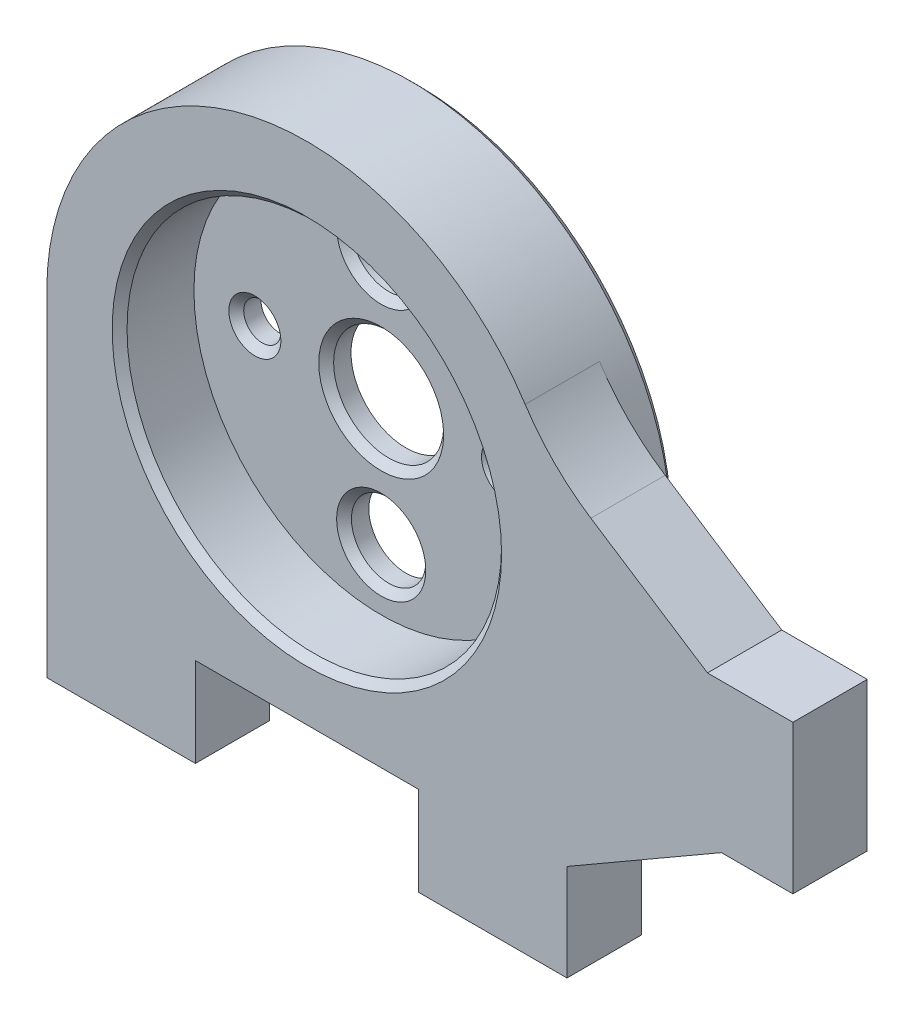
from build123d import *

# Parameters (mm, degrees)
SKETCH1_R           = 12.600000000000001
BOSS_EXTRUDE1_DEPTH = 2.5
BOSS_EXTRUDE3_DEPTH = 2.5
SKETCH4_R           = 1.2499999999999973
SKETCH4_R_2         = 2.5000000000000018
SKETCH4_R_3         = 3.7
BOSS_EXTRUDE4_DEPTH = 2.5
CUT_EXTRUDE1_START  = -0.8333333333333334
SKETCH5_R           = 2.249999999999998
SKETCH5_R_2         = 1.2499999999999973
SKETCH5_R_3         = 2.500000000000002
SKETCH5_R_4         = 3.7
SKETCH5_R_5         = 2.2499999999999987
CUT_EXTRUDE1_DEPTH  = 0.8333333333333334
CHAMFER1_SIZE       = 0.5
CHAMFER2_SIZE       = 0.5
FILLET2_R           = 15
CHAMFER6_SIZE       = 6
CHAMFER6_SIZE2      = 10.392304845413321


with BuildPart() as part:
    # Sketch1 → Boss-Extrude1 (new, symmetric)
    with BuildSketch(Plane.XY):
        with BuildLine():
            Line((-17.5, -22.500000000000004), (-7.500000000000002, -22.500000000000004))
            Line((-7.500000000000002, -22.500000000000004), (-7.500000000000002, -16.5))
            Line((-7.500000000000002, -16.5), (7.500000000000005, -16.5))
            Line((7.500000000000005, -16.5), (7.500000000000007, -22.500000000000004))
            Line((7.500000000000007, -22.500000000000004), (17.500000000000007, -22.5))
            Line((17.500000000000007, -22.5), (17.500000000000004, 0))
            ThreePointArc((17.500000000000004, 0), (-2.81e-15, 17.500000000000004), (-17.500000000000004, -6.94e-15))
            Line((-17.500000000000004, -6.94e-15), (-17.5, -22.500000000000004))
        make_face()
        Circle(SKETCH1_R, mode=Mode.SUBTRACT)
    extrude(amount=BOSS_EXTRUDE1_DEPTH, both=True)

    # Sketch3 → Boss-Extrude3 (add, symmetric)
    with BuildSketch(Plane.XY):
        Polygon((17.500000000000007, -10.000000000000002), (17.500000000000004, 0), (32.70000000000001, 0), (32.70000000000001, -10), align=None)
    extrude(amount=BOSS_EXTRUDE3_DEPTH, both=True)

    # Sketch4 → Boss-Extrude4 (add)
    with BuildSketch(Plane(origin=(0, 0, -2.5), x_dir=(-1, 0, 0), z_dir=(0, 0, -1))):
        with BuildLine():
            Line((5.8309518948453105, -16.5), (-5.8309518948453105, -16.5))
            ThreePointArc((-5.8309518948453105, -16.5), (4.96e-15, 17.500000000000004), (5.8309518948453105, -16.5))
        make_face()
        with Locations((-8.5, 0)):
            Circle(SKETCH4_R, mode=Mode.SUBTRACT)
        with Locations((8.5, 0)):
            Circle(SKETCH4_R, mode=Mode.SUBTRACT)
        with Locations((0, -8.5)):
            Circle(SKETCH4_R_2, mode=Mode.SUBTRACT)
        with Locations((0, 8.5)):
            Circle(SKETCH4_R_2, mode=Mode.SUBTRACT)
        Circle(SKETCH4_R_3, mode=Mode.SUBTRACT)
    extrude(amount=BOSS_EXTRUDE4_DEPTH)

    # Sketch5 → Cut-Extrude1 (cut)
    # profile 1 of 3: a face of its own
    with BuildSketch(Plane(origin=(0, 0, -5), x_dir=(-1, 0, 0), z_dir=(0, 0, -1)).offset(CUT_EXTRUDE1_START)):
        with Locations((-8.5, 0)):
            Circle(SKETCH5_R)
        with Locations((-8.5, 0)):
            Circle(SKETCH5_R_2, mode=Mode.SUBTRACT)
    # profile 2 of 3: a face of its own
    with BuildSketch(Plane(origin=(0, 0, -5), x_dir=(-1, 0, 0), z_dir=(0, 0, -1)).offset(CUT_EXTRUDE1_START)):
        with BuildLine():
            Line((3.500000000000002, 8.5), (4.7, 0))
            Line((4.7, 0), (3.500000000000002, -8.5))
            ThreePointArc((3.500000000000002, -8.5), (-6.4e-16, -12.000000000000002), (-3.500000000000002, -8.5))
            Line((-3.500000000000002, -8.5), (-4.7, 0))
            Line((-4.7, 0), (-3.500000000000002, 8.5))
            ThreePointArc((-3.500000000000002, 8.5), (2.1e-16, 12.000000000000002), (3.500000000000002, 8.5))
        make_face()
        with Locations((0, 8.5)):
            Circle(SKETCH5_R_3, mode=Mode.SUBTRACT)
        with Locations((0, -8.5)):
            Circle(SKETCH5_R_3, mode=Mode.SUBTRACT)
        Circle(SKETCH5_R_4, mode=Mode.SUBTRACT)
    # profile 3 of 3: a face of its own
    with BuildSketch(Plane(origin=(0, 0, -5), x_dir=(-1, 0, 0), z_dir=(0, 0, -1)).offset(CUT_EXTRUDE1_START)):
        with Locations((8.5, 0)):
            Circle(SKETCH5_R_5)
        with Locations((8.5, 0)):
            Circle(SKETCH5_R_2, mode=Mode.SUBTRACT)
    extrude(amount=CUT_EXTRUDE1_DEPTH, mode=Mode.SUBTRACT)

    # Chamfer1
    chamfer1_edges = [part.edges().sort_by_distance(p)[0] for p in [
        (-2.66e-15, 17.500000000000004, -5),
        (0, -16.5, -5),
        (10.749999999999998, 2.8e-16, -5),
        (-4.100000000000001, 4.25, -5),
        (-4.100000000000001, -4.25, -5),
        (-1e-17, 12, -5),
        (4.100000000000001, 4.25, -5),
        (4.100000000000001, -4.25, -5),
        (2.3e-16, -12, -5),
        (-6.250000000000002, 2.8e-16, -5),
    ]]
    chamfer(chamfer1_edges, length=CHAMFER1_SIZE)

    # Chamfer2
    chamfer2_edges = [part.edges().sort_by_distance(p)[0] for p in [
        (-12.600000000000001, 1.54e-15, 2.5),
        (3.7, 4.5e-16, -2.5),
        (2.5000000000000018, 8.5, -2.5),
        (2.5000000000000018, -8.5, -2.5),
        (-7.250000000000003, 1.5e-16, -2.5),
        (9.749999999999996, 1.5e-16, -2.5),
    ]]
    chamfer(chamfer2_edges, length=CHAMFER2_SIZE)

    # Chamfer4
    # the kernel refuses this chamfer: 12 mm, written as the material it adds along each edge
    with BuildSketch(Plane(origin=(17.500000000000004, 0, 2.5), x_dir=(0.999648118666469, -0.026526191709121207, 0), z_dir=(0, 0, -1))) as chamfer4_piece_1:
        with BuildLine():
            Line((9.855061796439113, 1e-17), (-2.110948481595115, -7.326644011468382))
            Line((-2.110948481595115, -7.326644011468382), (-2.3275279701108307, -7.223235476258414))
            ThreePointArc((-2.3275279701108307, -7.223235476258414), (-0.7534896907076923, -3.7391476844990703), (-0.239915548479951, 0.00636628601018905))
            Line((-0.239915548479951, 0.00636628601018905), (0.00636628601018909, 0.23991554847995256))
            ThreePointArc((0.00636628601018909, 0.23991554847995256), (4.93042998207199, 0.10925291314792994), (9.861428082449303, 0.2399155484799526))
            Line((9.861428082449303, 0.2399155484799526), (9.855061796439113, 1e-17))
        make_face()
    extrude(amount=5)

    # Fillet2
    fillet2_edges = [part.edges().sort_by_distance(p)[0] for p in [
        (15.986710313133337, 7.118644067795235, 0),
    ]]
    fillet(fillet2_edges, radius=FILLET2_R)

    # Chamfer6
    chamfer6_edges = [part.edges().sort_by_distance(p)[0] for p in [
        (17.500000000000007, -10.000000000000002, 0),
    ]]
    chamfer6_side = [part.faces().sort_by_distance(p)[0] for p in [
        (17.500000000000007, -16.25, 4e-17),
    ]]
    chamfer(chamfer6_edges, length=CHAMFER6_SIZE, length2=CHAMFER6_SIZE2, reference=chamfer6_side[0])


solid = part.part
